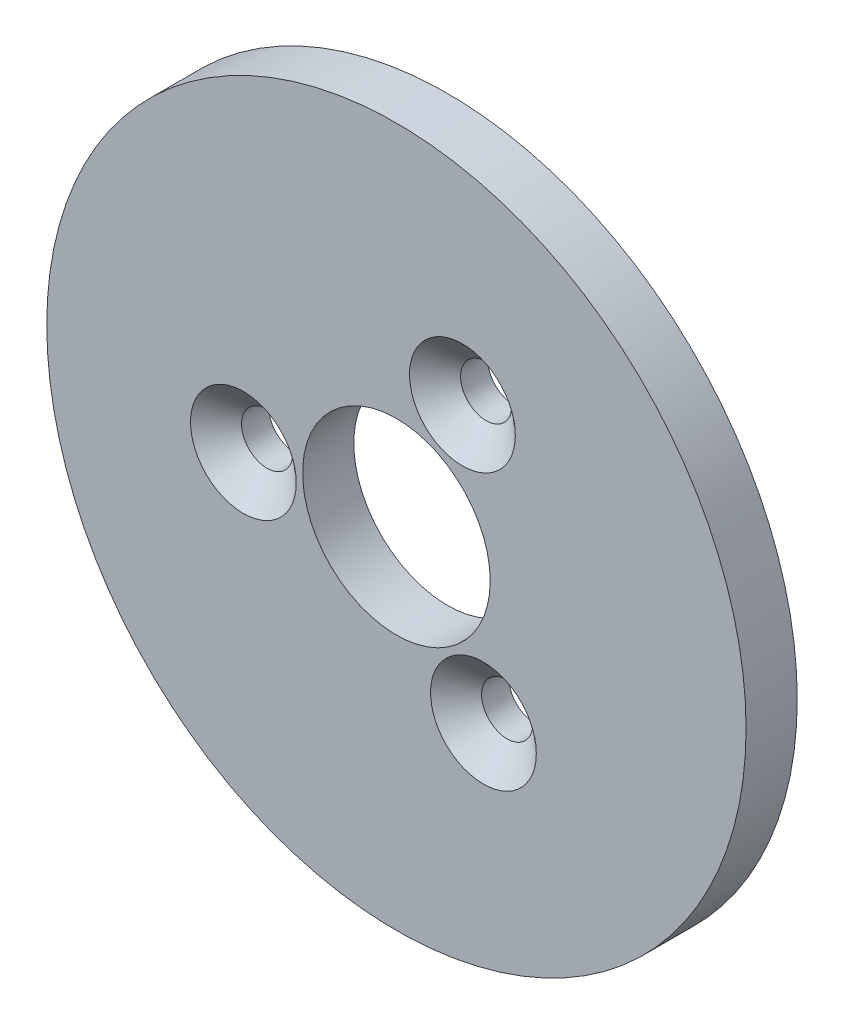
from build123d import *

# Parameters (mm, degrees)
SKETCH1_R           = 20.5
BOSS_EXTRUDE1_DEPTH = 3
SKETCH2_R           = 1.5
CUT_EXTRUDE1_DEPTH  = 30.146183284
CHAMFER1_SIZE       = 1.6
CHAMFER1_SIZE2      = 1.390858781
SKETCH3_R           = 5.5
CUT_EXTRUDE2_DEPTH  = 30.146183284


with BuildPart() as part:
    # Sketch1 → Boss-Extrude1 (new body)
    with BuildSketch(Plane.XY):
        Circle(SKETCH1_R)
    extrude(amount=BOSS_EXTRUDE1_DEPTH)

    # Sketch2 → Cut-Extrude1 (cut, through all)
    with BuildSketch(Plane.XY.offset(3)):
        with Locations((-8.971859678, -0.711149714)):
            Circle(SKETCH2_R)
        with Locations((5.101803557, -7.414283544)):
            Circle(SKETCH2_R)
        with Locations((3.870056121, 8.125433257)):
            Circle(SKETCH2_R)
    extrude(amount=-CUT_EXTRUDE1_DEPTH, mode=Mode.SUBTRACT)

    # Chamfer1
    chamfer1_edges = [part.edges().sort_by_distance(p)[0] for p in [
        (-10.471859678, -0.711149714, 3),
        (2.370056121, 8.125433257, 3),
        (3.601803557, -7.414283544, 3),
    ]]
    chamfer1_side = [part.faces().sort_by_distance(p)[0] for p in [
        (0, 0, 3),
    ]]
    chamfer(chamfer1_edges, length=CHAMFER1_SIZE, length2=CHAMFER1_SIZE2, reference=chamfer1_side[0])

    # Sketch3 → Cut-Extrude2 (cut, through all)
    with BuildSketch(Plane.XY.offset(3)):
        Circle(SKETCH3_R)
    extrude(amount=-CUT_EXTRUDE2_DEPTH, mode=Mode.SUBTRACT)


solid = part.part
